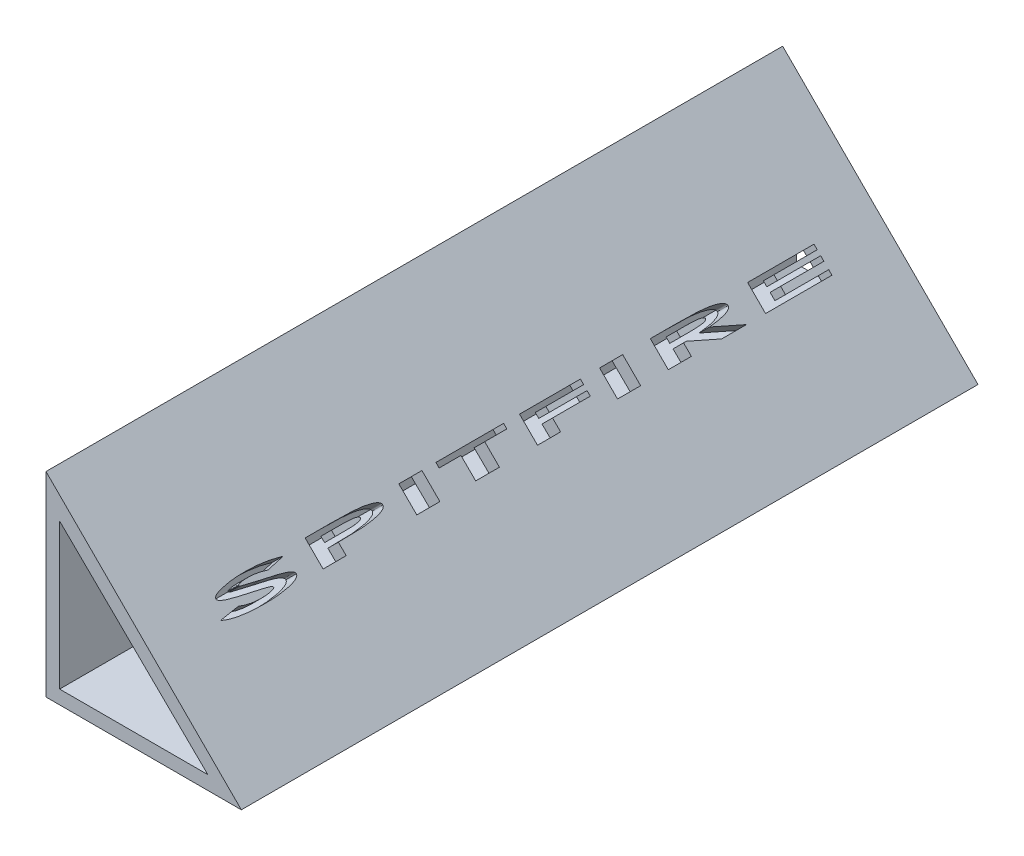
from build123d import *

# Parameters (mm, degrees)
BOSS_EXTRUDE1_DEPTH = 101.6
SKETCH2_W           = 3.185897436
SKETCH2_H           = 3.5
SKETCH2_W_2         = 3.185897435
CUT_EXTRUDE1_DEPTH  = 2.54


with BuildPart() as part:
    # Sketch1 → Boss-Extrude1 (new body)
    with BuildSketch(Plane.XY):
        Polygon((0, 0), (0, 26.940768363), (26.940768363, 0), align=None)
        Polygon((1.88087918, 21.95787584), (1.88087918, 1.890858369), (22.320889541, 1.890858369), align=None, mode=Mode.SUBTRACT)
    extrude(amount=BOSS_EXTRUDE1_DEPTH)

    # Sketch2 → Cut-Extrude1 (cut)
    # profile 1 of 8: a face of its own
    with BuildSketch(Plane(origin=(13.470384182, 13.470384182, 0), x_dir=(0, 0, -1), z_dir=(0.7071067811865415, 0.7071067811865536, 0))):
        with BuildLine():
            Line((-82.127509407, 0.33380751), (-84.508519022, -0.095980151))
            add(Edge.make_bspline(
                [(-84.508519022, -0.095980151), (-84.613022444, -0.067167759), (-84.821594052, -0.009662975), (-85.13745712, 0.062714119), (-85.454508898, 0.124629232), (-85.773025705, 0.175085873), (-86.093159979, 0.214482227), (-86.414713788, 0.242280378), (-86.737656931, 0.259777763), (-86.95330883, 0.261920942), (-87.061303477, 0.262994208)],
                knots=[0, 0, 0, 0, 1.005874516, 2.007559764, 3.006263449, 4.003204113, 4.999606765, 5.998858991, 6.997864059, 8, 8, 8, 8], degree=3))
            add(Edge.make_bspline(
                [(-87.061303477, 0.262994208), (-87.112953086, 0.262602305), (-87.213688402, 0.261837952), (-87.361195837, 0.259456817), (-87.501434473, 0.253662138), (-87.634433013, 0.246002386), (-87.760264395, 0.236590554), (-87.878674682, 0.223431521), (-87.990360042, 0.210182139), (-88.093740193, 0.192847456), (-88.187527441, 0.176382403), (-88.269191001, 0.15701574), (-88.338357091, 0.138567954), (-88.395319193, 0.12002042), (-88.440035618, 0.100196115), (-88.471878148, 0.079487483), (-88.494541622, 0.058323616), (-88.497838997, 0.041294672), (-88.499304279, 0.033727381)],
                knots=[0, 0, 0, 0, 1.666636863, 3.250541355, 4.759954333, 6.195150099, 7.549117587, 8.830760713, 10.039233546, 11.177330307, 12.212678914, 13.110822135, 13.884651333, 14.521366556, 15.044368695, 15.452212492, 15.75657522, 16, 16, 16, 16], degree=3))
            add(Edge.make_bspline(
                [(-88.499304279, 0.033727381), (-88.498475958, 0.026276153), (-88.496679849, 0.010119111), (-88.480351537, -0.01174811), (-88.457662651, -0.033723867), (-88.425266649, -0.054532397), (-88.384143571, -0.074192732), (-88.334884399, -0.095742429), (-88.276113789, -0.11550275), (-88.233634888, -0.127492443), (-88.211143221, -0.133840728)],
                knots=[0, 0, 0, 0, 0.508282645, 1.102146324, 1.819342487, 2.689946445, 3.733802709, 4.959749719, 6.390252713, 8, 8, 8, 8], degree=3))
            add(Edge.make_bspline(
                [(-88.211143221, -0.133840728), (-88.192689847, -0.138552097), (-88.151882744, -0.148970643), (-88.084418066, -0.165236808), (-88.004574107, -0.182352399), (-87.912530955, -0.202159071), (-87.808037324, -0.223774712), (-87.691251484, -0.247724211), (-87.561927937, -0.272785929), (-87.420303379, -0.300138017), (-87.266354914, -0.32969979), (-87.099867512, -0.360315688), (-86.921405578, -0.393531028), (-86.730296668, -0.427418519), (-86.527376453, -0.465056293), (-86.311796924, -0.503291233), (-86.084026941, -0.544256627), (-85.927837229, -0.571419744), (-85.84766165, -0.585363163)],
                knots=[0, 0, 0, 0, 0.379868533, 0.840027089, 1.384054868, 2.008491412, 2.71791334, 3.512337183, 4.386297271, 5.345289445, 6.389318679, 7.512948696, 8.721627913, 10.009938635, 11.384135509, 12.837969997, 14.376861188, 16, 16, 16, 16], degree=3))
            add(Edge.make_bspline(
                [(-85.84766165, -0.585363163), (-85.772641112, -0.598447821), (-85.626574441, -0.623923943), (-85.413217628, -0.661186891), (-85.211009975, -0.696183293), (-85.020020013, -0.729554737), (-84.84070563, -0.762310472), (-84.672519221, -0.791375729), (-84.516015262, -0.819635473), (-84.370552437, -0.845275756), (-84.236532502, -0.870284091), (-84.113661527, -0.892009734), (-84.00242205, -0.913863786), (-83.90221148, -0.931564633), (-83.813378416, -0.948290651), (-83.736109421, -0.963934204), (-83.670189863, -0.977185993), (-83.630010818, -0.985457213), (-83.611784247, -0.989209317)],
                knots=[0, 0, 0, 0, 1.608778854, 3.132328514, 4.575513193, 5.944045391, 7.228212209, 8.426285714, 9.549714044, 10.587913201, 11.54662121, 12.429815217, 13.223830698, 13.941425828, 14.579548777, 15.133396633, 15.606879444, 16, 16, 16, 16], degree=3))
            add(Edge.make_bspline(
                [(-83.611784247, -0.989209317), (-83.532969846, -1.006022467), (-83.381190199, -1.038400991), (-83.162939743, -1.089123461), (-82.962389282, -1.138257006), (-82.78006963, -1.188489879), (-82.614958156, -1.236308493), (-82.467692028, -1.284258391), (-82.338770903, -1.332702993), (-82.226317155, -1.379590046), (-82.129510596, -1.427632469), (-82.045757504, -1.475556989), (-81.974756874, -1.524643427), (-81.916497345, -1.575102898), (-81.870660076, -1.627240754), (-81.837633898, -1.680844456), (-81.817226116, -1.736118673), (-81.814663507, -1.773609057), (-81.813406843, -1.791993772)],
                knots=[0, 0, 0, 0, 1.882426185, 3.625149444, 5.233879169, 6.705248122, 8.042322702, 9.249057556, 10.321860475, 11.258765244, 12.093740569, 12.844696064, 13.511078919, 14.106809774, 14.640921393, 15.125901828, 15.571355534, 16, 16, 16, 16], degree=3))
            add(Edge.make_bspline(
                [(-81.813406843, -1.791993772), (-81.814512463, -1.809884594), (-81.816757363, -1.846210908), (-81.834725661, -1.899572133), (-81.86334878, -1.951432628), (-81.903729155, -2.001486873), (-81.954662229, -2.050875391), (-82.017588273, -2.097949264), (-82.090924144, -2.144426907), (-82.175639817, -2.188887544), (-82.27117067, -2.233313424), (-82.378506166, -2.275323161), (-82.49642653, -2.317659301), (-82.625809453, -2.358189236), (-82.766419631, -2.397143485), (-82.918454124, -2.434915247), (-83.08134484, -2.472027035), (-83.254865697, -2.507395159), (-83.437063329, -2.541986993), (-83.627279247, -2.572904418), (-83.824165036, -2.603587478), (-84.028083176, -2.630468386), (-84.238653571, -2.655849985), (-84.456036562, -2.678821685), (-84.680369459, -2.70016008), (-84.911610506, -2.717721994), (-85.149459735, -2.735212394), (-85.39423427, -2.748530334), (-85.645662647, -2.761702788), (-85.904183022, -2.77117911), (-86.169448405, -2.778860138), (-86.441488453, -2.784699849), (-86.720320458, -2.787114808), (-86.90845875, -2.78789329), (-87.00381149, -2.788287843)],
                knots=[0, 0, 0, 0, 0.314175361, 0.637915512, 0.980132039, 1.351892072, 1.764732403, 2.225202076, 2.731594403, 3.290713862, 3.906909913, 4.584068821, 5.317472497, 6.110619858, 6.968437451, 7.883780567, 8.866152956, 9.90705929, 10.998821379, 12.128204687, 13.296891794, 14.50393932, 15.746139461, 17.027803668, 18.349147555, 19.710038802, 21.10721459, 22.544367832, 24.022132775, 25.536138681, 27.094929187, 28.690403145, 30.322621469, 32, 32, 32, 32], degree=3))
            add(Edge.make_bspline(
                [(-87.00381149, -2.788287843), (-87.151986014, -2.787768191), (-87.443451668, -2.786746013), (-87.87351509, -2.778125409), (-88.289095028, -2.76429413), (-88.690192187, -2.744755703), (-89.076572527, -2.719630003), (-89.448243299, -2.688930534), (-89.805415738, -2.652483988), (-90.148426553, -2.610797096), (-90.47825705, -2.562216821), (-90.795559272, -2.507846291), (-91.100676113, -2.446892401), (-91.393768615, -2.379819476), (-91.674638291, -2.305240967), (-91.94409431, -2.225876666), (-92.201206041, -2.139221809), (-92.366690288, -2.074704326), (-92.448022227, -2.042995375)],
                knots=[0, 0, 0, 0, 1.28701507, 2.531613943, 3.736059817, 4.898582584, 6.019470808, 7.099046442, 8.137669859, 9.137760602, 10.10005626, 11.033156467, 11.933672931, 12.802304948, 13.644275032, 14.457401875, 15.241846284, 16, 16, 16, 16], degree=3))
            Line((-92.448022227, -2.042995375), (-89.734680881, -1.711364766))
            add(Edge.make_bspline(
                [(-89.734680881, -1.711364766), (-89.631037372, -1.747533388), (-89.421680528, -1.820592943), (-89.097673376, -1.910709081), (-88.762490201, -1.988203578), (-88.415671289, -2.050815335), (-88.057312356, -2.099977918), (-87.687719829, -2.134586968), (-87.306488726, -2.156210155), (-87.048478781, -2.158779247), (-86.917573509, -2.160082715)],
                knots=[0, 0, 0, 0, 0.918696494, 1.855739942, 2.813403213, 3.79766509, 4.804749982, 5.840368202, 6.904277945, 8, 8, 8, 8], degree=3))
            add(Edge.make_bspline(
                [(-86.917573509, -2.160082715), (-86.849560781, -2.159898909), (-86.716554634, -2.159539457), (-86.521159592, -2.154229409), (-86.334134918, -2.146954751), (-86.155332123, -2.135569948), (-85.98469214, -2.121584911), (-85.822390487, -2.105107015), (-85.668290519, -2.084841018), (-85.524391156, -2.06101078), (-85.393031242, -2.03666016), (-85.278030024, -2.00995313), (-85.180280544, -1.983499042), (-85.100442109, -1.954741777), (-85.037413611, -1.926179), (-84.991730402, -1.896757372), (-84.961418423, -1.864336236), (-84.956602876, -1.839600591), (-84.954432484, -1.828452106)],
                knots=[0, 0, 0, 0, 1.601897564, 3.132681599, 4.603675973, 6.010127906, 7.3522863, 8.636185549, 9.852232394, 11.0124001, 12.071488239, 12.998171713, 13.792868013, 14.45457454, 14.99630257, 15.416175962, 15.736867436, 16, 16, 16, 16], degree=3))
            add(Edge.make_bspline(
                [(-84.954432484, -1.828452106), (-84.956028801, -1.818121319), (-84.959450329, -1.795978432), (-84.982364403, -1.765274365), (-85.016482651, -1.735715324), (-85.064260708, -1.706414297), (-85.124451829, -1.676456806), (-85.198573593, -1.647922353), (-85.284994641, -1.61716338), (-85.366931995, -1.593920656), (-85.441299977, -1.57372294), (-85.506657043, -1.557943733), (-85.579667362, -1.540046937), (-85.661138336, -1.522178333), (-85.750564269, -1.502392042), (-85.848043618, -1.482143731), (-85.953506444, -1.461173245), (-86.066884704, -1.438893658), (-86.188008126, -1.414625951), (-86.317420314, -1.391219894), (-86.45481961, -1.365873267), (-86.600369249, -1.339184948), (-86.753917098, -1.311843029), (-86.915477558, -1.283957106), (-87.084844248, -1.254330236), (-87.200582947, -1.234777124), (-87.259720945, -1.22478624)],
                knots=[0, 0, 0, 0, 0.306594716, 0.657151567, 1.104699661, 1.647993096, 2.315740494, 3.101115435, 4.0060184, 5.041070843, 5.630682601, 6.296005962, 7.038838194, 7.86442085, 8.774373091, 9.760483519, 10.822831203, 11.969625142, 13.194055764, 14.493528603, 15.877476138, 17.345899778, 18.890735733, 20.512011897, 22.217773014, 24, 24, 24, 24], degree=3))
            add(Edge.make_bspline(
                [(-87.259720945, -1.22478624), (-87.372383285, -1.205712238), (-87.592860806, -1.168384868), (-87.91555394, -1.112193641), (-88.223168202, -1.058283296), (-88.515330118, -1.005833973), (-88.792197341, -0.954463045), (-89.054018251, -0.905510345), (-89.300405258, -0.85810755), (-89.531415121, -0.811420035), (-89.747272419, -0.76770281), (-89.947696811, -0.724685468), (-90.132908011, -0.684287079), (-90.302631879, -0.645175429), (-90.456985149, -0.606998172), (-90.596289186, -0.571894369), (-90.720011494, -0.537170455), (-90.830003985, -0.50487829), (-90.929326556, -0.472735232), (-91.020592286, -0.440553869), (-91.105929402, -0.408830884), (-91.185084149, -0.377896089), (-91.257202543, -0.345234923), (-91.323489038, -0.313715058), (-91.383675803, -0.28266468), (-91.437205038, -0.250623683), (-91.485274603, -0.219840618), (-91.525687984, -0.186934868), (-91.561372075, -0.156072439), (-91.589514805, -0.123881632), (-91.612722132, -0.092717189), (-91.628008861, -0.060438746), (-91.638999123, -0.028688357), (-91.639892613, -0.007024128), (-91.64032992, 0.003579144)],
                knots=[0, 0, 0, 0, 2.363007144, 4.624348831, 6.773693072, 8.821418104, 10.762806124, 12.597009338, 14.329701266, 15.951458661, 17.470863364, 18.884210053, 20.19056836, 21.391076363, 22.485911874, 23.478774114, 24.361744477, 25.143162773, 25.849286379, 26.520316787, 27.144250088, 27.732098413, 28.277292796, 28.780975901, 29.250081892, 29.67695384, 30.071048585, 30.428825864, 30.753936943, 31.044925883, 31.311796764, 31.553884511, 31.781654634, 32, 32, 32, 32], degree=3))
            add(Edge.make_bspline(
                [(-91.64032992, 0.003579144), (-91.639499726, 0.018928355), (-91.63781786, 0.050023864), (-91.619889953, 0.095060637), (-91.593578145, 0.139219142), (-91.5561868, 0.182131684), (-91.508605721, 0.224130911), (-91.450839452, 0.265508738), (-91.382034714, 0.305029327), (-91.303825207, 0.344998045), (-91.214717766, 0.383493538), (-91.115381305, 0.420951518), (-91.005698293, 0.458083777), (-90.885834832, 0.49465266), (-90.755093133, 0.529107062), (-90.614357696, 0.564597302), (-90.462721888, 0.597812977), (-90.301694492, 0.630608344), (-90.132950971, 0.662048507), (-89.95847799, 0.691055815), (-89.779378864, 0.719792288), (-89.595024787, 0.744269246), (-89.405842662, 0.76875415), (-89.211718115, 0.789101342), (-89.012889187, 0.809156671), (-88.809062274, 0.826507922), (-88.600347052, 0.84190708), (-88.386726296, 0.85525491), (-88.168427061, 0.866398465), (-87.944991786, 0.875512822), (-87.716881473, 0.882552242), (-87.483624226, 0.887124564), (-87.245712365, 0.891195272), (-87.085377202, 0.891197974), (-87.004512612, 0.891199337)],
                knots=[0, 0, 0, 0, 0.301821153, 0.611450517, 0.944781957, 1.314839262, 1.730060762, 2.19643969, 2.715855256, 3.296037901, 3.93074712, 4.632122178, 5.392758987, 6.217910806, 7.107103646, 8.063341921, 9.084876612, 10.173186597, 11.30958158, 12.475380363, 13.667036698, 14.892553144, 16.148908631, 17.435214973, 18.748122664, 20.096533408, 21.476056463, 22.882274221, 24.324579936, 25.793919363, 27.299674118, 28.832761856, 30.402612329, 32, 32, 32, 32], degree=3))
            add(Edge.make_bspline(
                [(-87.004512612, 0.891199337), (-86.796726184, 0.889704177), (-86.385939386, 0.886748297), (-85.777403319, 0.863672777), (-85.183774078, 0.827031706), (-84.697296173, 0.782986062), (-84.310461582, 0.739019617), (-84.015945014, 0.699681602), (-83.715440709, 0.65381409), (-83.408845962, 0.603097664), (-83.096995045, 0.544322294), (-82.779053111, 0.480646232), (-82.455068952, 0.410633711), (-82.237511213, 0.359607463), (-82.127509407, 0.33380751)],
                knots=[0, 0, 0, 0, 1.520004794, 3.004998488, 4.454207064, 5.870493619, 6.577743737, 7.302155888, 8.043971384, 8.801445664, 9.575365128, 10.365313525, 11.173467851, 12, 12, 12, 12], degree=3))
        make_face()
    # profile 2 of 8: a face of its own
    with BuildSketch(Plane(origin=(13.470384182, 13.470384182, 0), x_dir=(0, 0, -1), z_dir=(0.7071067811865415, 0.7071067811865536, 0))):
        with BuildLine():
            Line((-78.762124791, 0.801455747), (-75.361684086, 0.801455747))
            add(Edge.make_bspline(
                [(-75.361684086, 0.801455747), (-75.248803597, 0.801191414), (-75.02701562, 0.800672053), (-74.700289034, 0.800429456), (-74.385485491, 0.798078595), (-74.082601186, 0.795257095), (-73.791857832, 0.792128259), (-73.513061454, 0.786635418), (-73.246378788, 0.782341486), (-72.991646252, 0.775726891), (-72.74905398, 0.768814151), (-72.518380279, 0.761136752), (-72.299864288, 0.752675723), (-72.093231923, 0.743923742), (-71.89883489, 0.73290731), (-71.716241532, 0.722975388), (-71.545890552, 0.710807044), (-71.337320013, 0.694367092), (-71.091855154, 0.670753893), (-70.8109354, 0.640198077), (-70.546517537, 0.602939644), (-70.297745352, 0.564629615), (-70.065448476, 0.52025733), (-69.848814605, 0.472851748), (-69.648465994, 0.421438588), (-69.49229653, 0.373806137), (-69.37621091, 0.334154474), (-69.296429846, 0.303777754), (-69.221686004, 0.274068266), (-69.153076187, 0.242348882), (-69.08981532, 0.210258073), (-69.03210565, 0.177122328), (-68.979476457, 0.143732069), (-68.932333476, 0.10938532), (-68.890738439, 0.074348731), (-68.854763182, 0.038546493), (-68.824244287, 0.002047999), (-68.799702593, -0.0355184), (-68.779204369, -0.073376051), (-68.76652034, -0.112934732), (-68.757251856, -0.152579582), (-68.756226584, -0.179360062), (-68.755714535, -0.192734958)],
                knots=[0, 0, 0, 0, 1.966831115, 3.864436592, 5.69285272, 7.452077653, 9.142124036, 10.759001154, 12.310735137, 13.789363647, 15.198900441, 16.539371724, 17.810807973, 19.009176768, 20.142868751, 21.203376655, 22.195316785, 23.11852693, 24.848711748, 26.49187565, 28.041593987, 29.501044737, 30.877109107, 32.16152112, 33.364495762, 34.480014824, 35.00542689, 35.501572451, 35.967379302, 36.406506356, 36.818091272, 37.202964477, 37.565564825, 37.903574102, 38.218498211, 38.512198371, 38.786967435, 39.045602232, 39.293298732, 39.534104467, 39.767319172, 40, 40, 40, 40], degree=3))
            add(Edge.make_bspline(
                [(-68.755714535, -0.192734958), (-68.756314283, -0.207541345), (-68.757521686, -0.237349312), (-68.769853849, -0.281073422), (-68.787012932, -0.324435165), (-68.813090738, -0.366224862), (-68.846216415, -0.406555077), (-68.886054665, -0.446355146), (-68.933430605, -0.484820879), (-68.987934643, -0.52235836), (-69.049790586, -0.558844405), (-69.117943156, -0.595499093), (-69.194570163, -0.629339488), (-69.277531788, -0.66395171), (-69.368287068, -0.696490902), (-69.465645831, -0.728939193), (-69.570519519, -0.759621629), (-69.682117243, -0.789403178), (-69.799831033, -0.819011835), (-69.923059041, -0.846904325), (-70.051690351, -0.873410483), (-70.185322023, -0.899445534), (-70.324171003, -0.923950861), (-70.468212755, -0.946904403), (-70.617041436, -0.969464987), (-70.771349934, -0.99035788), (-70.930470769, -1.010795078), (-71.09506078, -1.029512674), (-71.264690746, -1.047958867), (-71.439757818, -1.06470632), (-71.619991567, -1.07989567), (-71.805057756, -1.094823899), (-71.995303977, -1.108172987), (-72.12389599, -1.115766915), (-72.189107965, -1.119617971)],
                knots=[0, 0, 0, 0, 0.383298357, 0.771649739, 1.171481959, 1.590671605, 2.043441402, 2.523767243, 3.049504218, 3.62488345, 4.239609434, 4.91247247, 5.631760437, 6.412289929, 7.244990005, 8.132994023, 9.075262304, 10.080100629, 11.130384456, 12.225050899, 13.35862749, 14.538583642, 15.758076964, 17.017414319, 18.323763134, 19.66440909, 21.05837669, 22.487009837, 23.963193694, 25.486421992, 27.050835222, 28.657060735, 30.304718436, 32, 32, 32, 32], degree=3))
            add(Edge.make_bspline(
                [(-72.189107965, -1.119617971), (-72.229771342, -1.121753974), (-72.315293955, -1.126246384), (-72.449431751, -1.132611523), (-72.595504886, -1.138206649), (-72.75350804, -1.142851304), (-72.923400611, -1.148028641), (-73.105239926, -1.151901485), (-73.298973108, -1.156376027), (-73.504639871, -1.159790925), (-73.722460634, -1.162450156), (-73.951961754, -1.165171101), (-74.193607288, -1.168450138), (-74.446954689, -1.169315559), (-74.712444998, -1.170830823), (-74.989620561, -1.17236811), (-75.278951381, -1.173046148), (-75.475733215, -1.172951542), (-75.576227356, -1.172903228)],
                knots=[0, 0, 0, 0, 0.57692024, 1.213370086, 1.9026104, 2.647992474, 3.452949586, 4.310782328, 5.224891422, 6.198527095, 7.225086756, 8.311243457, 9.450375716, 10.649050996, 11.900704815, 13.211959567, 14.576180929, 16, 16, 16, 16], degree=3))
            Line((-75.576227356, -1.172903228), (-75.576227356, -2.698544253))
            Line((-75.576227356, -2.698544253), (-78.762124791, -2.698544253))
            Line((-78.762124791, -2.698544253), (-78.762124791, 0.801455747))
        make_face()
        with BuildLine():
            Line((-75.576227356, -0.544698099), (-74.549785048, -0.544698099))
            add(Edge.make_bspline(
                [(-74.549785048, -0.544698099), (-74.500238961, -0.544762665), (-74.403249582, -0.544889057), (-74.260689037, -0.543983807), (-74.123970878, -0.543257143), (-73.9928566, -0.542834466), (-73.867360761, -0.541116225), (-73.747694451, -0.5400476), (-73.633885516, -0.537707645), (-73.525913931, -0.53558596), (-73.423536712, -0.533764285), (-73.327029077, -0.530665025), (-73.236330956, -0.528177807), (-73.15150999, -0.524455661), (-73.072285104, -0.5209344), (-72.998637778, -0.517706997), (-72.930885339, -0.513290589), (-72.849266278, -0.507925766), (-72.754122565, -0.499592518), (-72.645193222, -0.488439598), (-72.542552049, -0.475979585), (-72.446235723, -0.461960705), (-72.356444341, -0.446618127), (-72.272956655, -0.42986502), (-72.195751114, -0.411742775), (-72.125093326, -0.392207364), (-72.06160714, -0.371885356), (-72.006619964, -0.348983574), (-71.959270232, -0.326732646), (-71.921108444, -0.301666405), (-71.889981749, -0.277041918), (-71.868484182, -0.249865897), (-71.854336505, -0.221580149), (-71.852681172, -0.201763887), (-71.851868381, -0.192033837)],
                knots=[0, 0, 0, 0, 1.702344336, 3.332439116, 4.898295298, 6.399912951, 7.837359443, 9.210570723, 10.511641788, 11.748485028, 12.921101712, 14.029696921, 15.06605525, 16.038505494, 16.946774977, 17.790872621, 18.571264121, 19.2795382, 20.601235743, 21.852487885, 23.041703405, 24.153464003, 25.196365631, 26.171166911, 27.078797243, 27.920408585, 28.689816311, 29.366810996, 29.966534133, 30.483264714, 30.933585376, 31.322353235, 31.667266371, 32, 32, 32, 32], degree=3))
            add(Edge.make_bspline(
                [(-71.851868381, -0.192033837), (-71.852332127, -0.183523893), (-71.85326191, -0.166461948), (-71.863433306, -0.142000419), (-71.878391183, -0.118319355), (-71.900050554, -0.096119282), (-71.926810354, -0.07401738), (-71.960446442, -0.054286619), (-71.998725894, -0.033708276), (-72.04332825, -0.014794586), (-72.094203076, 0.00225033), (-72.150582536, 0.020054776), (-72.213204751, 0.035779037), (-72.281439403, 0.051336578), (-72.355816586, 0.065899739), (-72.436180944, 0.080015333), (-72.522511567, 0.09240717), (-72.581958974, 0.099952369), (-72.612585529, 0.103839561)],
                knots=[0, 0, 0, 0, 0.473423519, 0.949186723, 1.460431197, 2.033735821, 2.674709878, 3.396536393, 4.20920566, 5.105064157, 6.10123448, 7.209200695, 8.410666088, 9.710676755, 11.123046974, 12.648683812, 14.273444167, 16, 16, 16, 16], degree=3))
            add(Edge.make_bspline(
                [(-72.612585529, 0.103839561), (-72.63687877, 0.106761459), (-72.687979475, 0.112907657), (-72.768455042, 0.120109483), (-72.856017809, 0.128379384), (-72.950991368, 0.134049012), (-73.053316708, 0.140779235), (-73.163199903, 0.145904169), (-73.280477276, 0.152110761), (-73.405089841, 0.155666987), (-73.537115299, 0.160233302), (-73.676411835, 0.163644227), (-73.823189016, 0.166253021), (-73.977428948, 0.169202322), (-74.139154308, 0.171589342), (-74.308135329, 0.171476341), (-74.484343067, 0.173724761), (-74.604238136, 0.173410908), (-74.665470144, 0.173250619)],
                knots=[0, 0, 0, 0, 0.57148448, 1.202114621, 1.887104709, 2.625681902, 3.424183164, 4.282330578, 5.194999739, 6.167222429, 7.19400403, 8.280653022, 9.421756356, 10.62289632, 11.883991207, 13.199579332, 14.569787877, 16, 16, 16, 16], degree=3))
            Line((-74.665470144, 0.173250619), (-75.576227356, 0.173250619))
            Line((-75.576227356, 0.173250619), (-75.576227356, -0.544698099))
        make_face(mode=Mode.SUBTRACT)
    # profile 3 of 8: a face of its own
    with BuildSketch(Plane(origin=(13.470384182, 13.470384182, 0), x_dir=(0, 0, -1), z_dir=(0.7071067811865415, 0.7071067811865536, 0))):
        with Locations((-64.24609915, -0.948544253)):
            Rectangle(SKETCH2_W, SKETCH2_H)
    # profile 4 of 8: a face of its own
    with BuildSketch(Plane(origin=(13.470384182, 13.470384182, 0), x_dir=(0, 0, -1), z_dir=(0.7071067811865415, 0.7071067811865536, 0))):
        Polygon((-60.723663253, 0.801455747), (-51.39032992, 0.801455747), (-51.39032992, 0.173250619), (-54.441611971, 0.173250619), (-54.441611971, -2.698544253), (-57.717252997, -2.698544253), (-57.717252997, 0.173250619), (-60.723663253, 0.173250619), align=None)
    # profile 5 of 8: a face of its own
    with BuildSketch(Plane(origin=(13.470384182, 13.470384182, 0), x_dir=(0, 0, -1), z_dir=(0.7071067811865415, 0.7071067811865536, 0))):
        Polygon((-49.191611971, 0.801455747), (-40.80058633, 0.801455747), (-40.80058633, 0.173250619), (-46.005714535, 0.173250619), (-46.005714535, -0.499826304), (-40.80058633, -0.499826304), (-40.80058633, -1.128031433), (-46.005714535, -1.128031433), (-46.005714535, -2.698544253), (-49.191611971, -2.698544253), align=None)
    # profile 6 of 8: a face of its own
    with BuildSketch(Plane(origin=(13.470384182, 13.470384182, 0), x_dir=(0, 0, -1), z_dir=(0.7071067811865415, 0.7071067811865536, 0))):
        with Locations((-36.560201715, -0.948544253)):
            Rectangle(SKETCH2_W_2, SKETCH2_H)
    # profile 7 of 8: a face of its own
    with BuildSketch(Plane(origin=(13.470384182, 13.470384182, 0), x_dir=(0, 0, -1), z_dir=(0.7071067811865415, 0.7071067811865536, 0))):
        with BuildLine():
            Line((-31.153150432, 0.801455747), (-27.752709727, 0.801455747))
            add(Edge.make_bspline(
                [(-27.752709727, 0.801455747), (-27.638427008, 0.801190522), (-27.414068276, 0.800669835), (-27.083835916, 0.800439824), (-26.765994877, 0.798046613), (-26.460771014, 0.795371691), (-26.168170273, 0.791755837), (-25.888175354, 0.787936715), (-25.620599803, 0.781762043), (-25.365598195, 0.776766669), (-25.123254167, 0.769439278), (-24.89351395, 0.761851057), (-24.676161941, 0.753452805), (-24.471429329, 0.744373437), (-24.279312845, 0.734628141), (-24.099824563, 0.724065693), (-23.932902855, 0.713222985), (-23.729556273, 0.696190009), (-23.490059681, 0.673913414), (-23.215377544, 0.642462528), (-22.955166711, 0.606871257), (-22.709658532, 0.567082459), (-22.478637189, 0.522998674), (-22.262053502, 0.474870287), (-22.059670547, 0.422534005), (-21.901022158, 0.374272107), (-21.78200427, 0.335162846), (-21.700614725, 0.303587234), (-21.624230511, 0.273459423), (-21.553821666, 0.241404639), (-21.4885205, 0.209853316), (-21.429762598, 0.17580354), (-21.376044336, 0.142122122), (-21.327672703, 0.108191402), (-21.285271518, 0.072960823), (-21.248648412, 0.036921309), (-21.216738626, 0.000859619), (-21.191275254, -0.036706612), (-21.171518905, -0.074610086), (-21.157068279, -0.11314763), (-21.14837573, -0.152614744), (-21.147284944, -0.179371774), (-21.146740176, -0.192734958)],
                knots=[0, 0, 0, 0, 1.992134582, 3.910939369, 5.756450346, 7.532739535, 9.23167225, 10.85733667, 12.41390248, 13.897155205, 15.303236284, 16.640222223, 17.904072824, 19.094825965, 20.212526954, 21.257230603, 22.229004078, 23.128253929, 24.814198207, 26.421649683, 27.947275241, 29.39192037, 30.756581081, 32.046414927, 33.258825676, 34.399404721, 34.936617347, 35.442042015, 35.920909982, 36.367646494, 36.790330607, 37.184467267, 37.550664103, 37.895431401, 38.213612095, 38.510335362, 38.790487257, 39.05150227, 39.299307101, 39.533900706, 39.767217408, 40, 40, 40, 40], degree=3))
            add(Edge.make_bspline(
                [(-21.146740176, -0.192734958), (-21.147138858, -0.206826966), (-21.147933122, -0.234901436), (-21.158772126, -0.276043213), (-21.174068352, -0.316498742), (-21.19625238, -0.355994933), (-21.224398818, -0.394453159), (-21.258832469, -0.432134264), (-21.299028479, -0.468963431), (-21.346291558, -0.504009945), (-21.398902366, -0.539341229), (-21.458289581, -0.573294703), (-21.523780251, -0.606073717), (-21.594984384, -0.638664735), (-21.672612877, -0.669689347), (-21.756304902, -0.701035574), (-21.846618535, -0.729862882), (-21.942866412, -0.75881667), (-22.045304503, -0.786693392), (-22.153904513, -0.814219132), (-22.269037506, -0.839860832), (-22.390335917, -0.8651463), (-22.517975989, -0.889570039), (-22.651834646, -0.913583757), (-22.792147036, -0.935823576), (-22.938766192, -0.957226057), (-23.091423317, -0.979718358), (-23.250794867, -0.998434509), (-23.416132786, -1.018709268), (-23.587988199, -1.036532986), (-23.76583665, -1.054116442), (-23.950005355, -1.070907554), (-24.140446333, -1.087257714), (-24.269758752, -1.096628818), (-24.335442099, -1.101388804)],
                knots=[0, 0, 0, 0, 0.390335102, 0.777635904, 1.174235614, 1.589721599, 2.031169306, 2.495322447, 3.005324044, 3.542799704, 4.127906418, 4.764769869, 5.441161641, 6.16156523, 6.939044486, 7.76260567, 8.643231273, 9.571492164, 10.554128465, 11.591620691, 12.682930081, 13.829959669, 15.033000718, 16.292305628, 17.607053265, 18.978551392, 20.40786358, 21.892527691, 23.435189547, 25.034457814, 26.691183508, 28.398992102, 30.170892974, 32, 32, 32, 32], degree=3))
            Line((-24.335442099, -1.101388804), (-20.361483766, -2.698544253))
            Line((-20.361483766, -2.698544253), (-23.79277383, -2.698544253))
            Line((-23.79277383, -2.698544253), (-27.587946106, -1.172903228))
            Line((-27.587946106, -1.172903228), (-27.967252997, -1.172903228))
            Line((-27.967252997, -1.172903228), (-27.967252997, -2.698544253))
            Line((-27.967252997, -2.698544253), (-31.153150432, -2.698544253))
            Line((-31.153150432, -2.698544253), (-31.153150432, 0.801455747))
        make_face()
        with BuildLine():
            Line((-27.967252997, -0.544698099), (-26.952729759, -0.544698099))
            add(Edge.make_bspline(
                [(-26.952729759, -0.544698099), (-26.8896283, -0.544831388), (-26.765760675, -0.545093032), (-26.583939752, -0.543215295), (-26.409591342, -0.542028737), (-26.242944693, -0.540222727), (-26.083573501, -0.536228826), (-25.931649511, -0.533062364), (-25.787217745, -0.528774735), (-25.65048905, -0.524016072), (-25.521506214, -0.51807955), (-25.399924186, -0.51300055), (-25.285894901, -0.505721161), (-25.179298444, -0.498245232), (-25.080258138, -0.489435036), (-24.988520571, -0.48171237), (-24.904477931, -0.471408772), (-24.805134259, -0.459105008), (-24.694272299, -0.440897336), (-24.575644303, -0.415649015), (-24.475164688, -0.386452742), (-24.392547666, -0.354238055), (-24.327137148, -0.31831137), (-24.280007688, -0.278343756), (-24.248372951, -0.233546076), (-24.244684032, -0.20040356), (-24.242894022, -0.184321497)],
                knots=[0, 0, 0, 0, 1.613994843, 3.168258082, 4.650790441, 6.073610027, 7.430890379, 8.728408307, 9.960348813, 11.126762565, 12.227709282, 13.262966655, 14.239173266, 15.150168783, 15.996079722, 16.782444731, 17.504641109, 18.161569319, 19.342823441, 20.376992969, 21.262185804, 22.015905085, 22.642430091, 23.159221071, 23.592020707, 24, 24, 24, 24], degree=3))
            add(Edge.make_bspline(
                [(-24.242894022, -0.184321497), (-24.243655214, -0.174800555), (-24.245241239, -0.154962648), (-24.260943394, -0.12716374), (-24.284430036, -0.100802132), (-24.316100333, -0.074719828), (-24.357819369, -0.051743338), (-24.406995576, -0.027240293), (-24.466069132, -0.005733078), (-24.533092387, 0.016109551), (-24.607846316, 0.036007605), (-24.689216168, 0.054947858), (-24.77670926, 0.072219903), (-24.870139843, 0.088674731), (-24.969884432, 0.102057215), (-25.075648169, 0.115928472), (-25.187701795, 0.126599687), (-25.28562936, 0.135106387), (-25.369586145, 0.140477242), (-25.439700039, 0.14464809), (-25.515869785, 0.149050674), (-25.598394652, 0.152258233), (-25.687185564, 0.156044591), (-25.782557109, 0.158561139), (-25.884218249, 0.16138515), (-25.992181725, 0.164415595), (-26.106243187, 0.166177037), (-26.226593844, 0.168626361), (-26.353271638, 0.169663638), (-26.486479907, 0.17139085), (-26.625773757, 0.171807426), (-26.771372784, 0.172540126), (-26.923281704, 0.17344049), (-27.026814827, 0.17331476), (-27.079632804, 0.173250619)],
                knots=[0, 0, 0, 0, 0.309745675, 0.645388434, 1.02000325, 1.466141562, 1.980994053, 2.576939538, 3.265305332, 4.037849801, 4.886814324, 5.798884534, 6.77508786, 7.808715109, 8.906879604, 10.072351027, 11.303737193, 12.594735395, 13.293123689, 14.060297779, 14.896280056, 15.793080208, 16.766395709, 17.808329857, 18.919157782, 20.098882748, 21.347343084, 22.657057283, 24.043234278, 25.498328985, 27.022284045, 28.607502114, 30.269299019, 32, 32, 32, 32], degree=3))
            Line((-27.079632804, 0.173250619), (-27.967252997, 0.173250619))
            Line((-27.967252997, 0.173250619), (-27.967252997, -0.544698099))
        make_face(mode=Mode.SUBTRACT)
    # profile 8 of 8: a face of its own
    with BuildSketch(Plane(origin=(13.470384182, 13.470384182, 0), x_dir=(0, 0, -1), z_dir=(0.7071067811865415, 0.7071067811865536, 0))):
        Polygon((-17.736483766, 0.801455747), (-8.582637612, 0.801455747), (-8.582637612, 0.173250619), (-14.55058633, 0.173250619), (-14.55058633, -0.499826304), (-8.582637612, -0.499826304), (-8.582637612, -1.128031433), (-14.55058633, -1.128031433), (-14.55058633, -2.070339125), (-8.582637612, -2.070339125), (-8.582637612, -2.698544253), (-17.736483766, -2.698544253), align=None)
    extrude(amount=-CUT_EXTRUDE1_DEPTH, mode=Mode.SUBTRACT)


with BuildPart() as cut_extrude1_piece_1:
    # of the separate pieces the step leaves, piece 1, a body of its own (cut_extrude1_pieces)
    add(part.part.solids().sort_by_distance((0, 0, 0))[0])


with BuildPart() as cut_extrude1_piece_2:
    # of the separate pieces the step leaves, piece 2, a body of its own (cut_extrude1_pieces)
    add(part.part.solids().sort_by_distance((13.347877494, 13.592890869, 75.576227356))[0])


with BuildPart() as cut_extrude1_piece_3:
    # of the separate pieces the step leaves, piece 3, a body of its own (cut_extrude1_pieces)
    add(part.part.solids().sort_by_distance((13.347877494, 13.592890869, 27.967252997))[0])


solid = Compound([cut_extrude1_piece_1.part, cut_extrude1_piece_2.part, cut_extrude1_piece_3.part])
